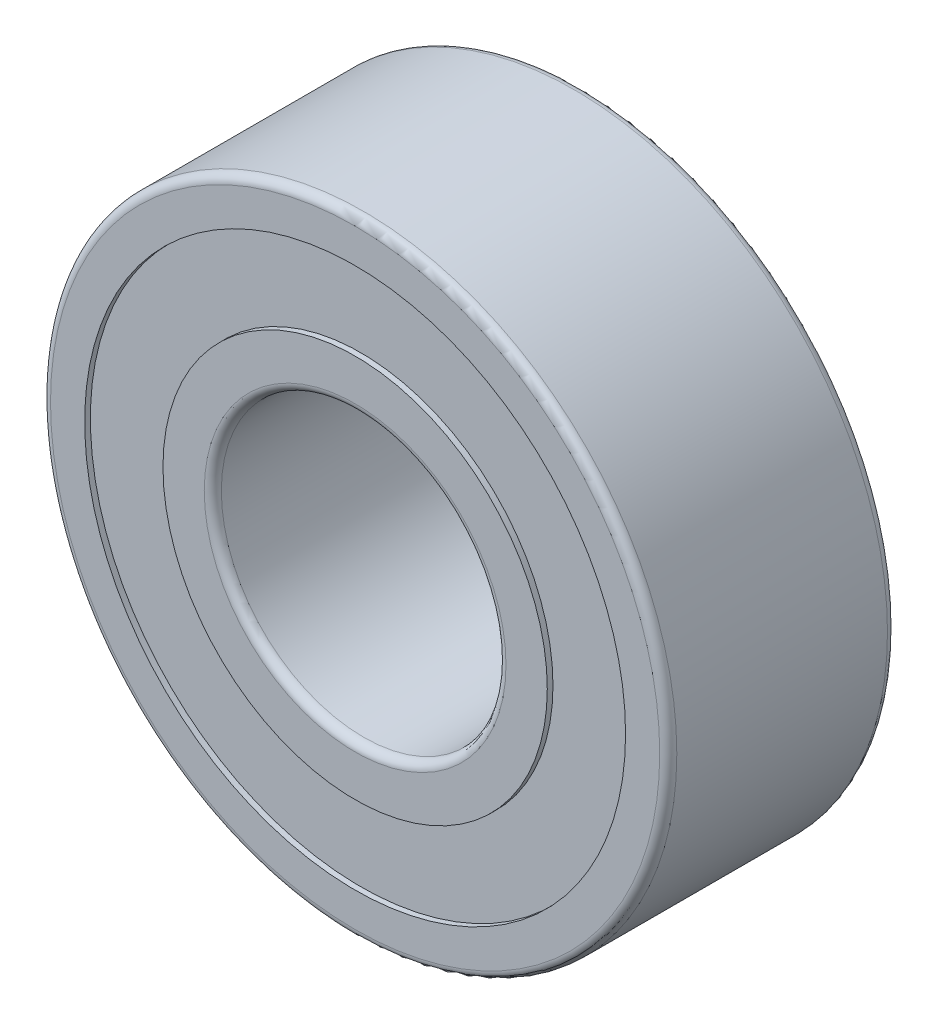
from build123d import *

# Parameters (mm, degrees)
SKETCH1_R             = 11
SKETCH1_R_2           = 5
BOSS_EXTRUDE1_DEPTH   = 4
SKETCH2_R             = 9.5
SKETCH2_R_2           = 6.75
CUT_EXTRUDE1_DEPTH    = 0.1
MIRROR1_START         = -4
MIRROR1_OUTLINE_R     = 9.5
MIRROR1_OUTLINE_R_2   = 6.75
MIRROR1_DEPTH         = 0.1
MIRROR1_START_2       = 3.8
MIRROR1_2_OUTLINE_R   = 9.5
MIRROR1_2_OUTLINE_R_2 = 6.75
MIRROR1_2_DEPTH       = 0.1
FILLET1_R             = 0.3


# Read off the part's stored shape, not the designer's step: Mirror1
with BuildPart() as part:
    # Sketch1 → Boss-Extrude1 (new, symmetric)
    with BuildSketch(Plane.XY):
        Circle(SKETCH1_R)
        Circle(SKETCH1_R_2, mode=Mode.SUBTRACT)
    extrude(amount=BOSS_EXTRUDE1_DEPTH, both=True)

    # Sketch2 → Cut-Extrude1 (cut)
    with BuildSketch(Plane.XY.offset(4)):
        Circle(SKETCH2_R)
        Circle(SKETCH2_R_2, mode=Mode.SUBTRACT)
    extrude(amount=-CUT_EXTRUDE1_DEPTH, mode=Mode.SUBTRACT)

    # Mirror1 outline → Mirror1 (cut)
    with BuildSketch(Plane.XY.offset(MIRROR1_START)):
        Circle(MIRROR1_OUTLINE_R)
        Circle(MIRROR1_OUTLINE_R_2, mode=Mode.SUBTRACT)
    extrude(amount=MIRROR1_DEPTH, mode=Mode.SUBTRACT)

    # Mirror1 2 outline → Mirror1 2 (cut)
    with BuildSketch(Plane.XY.offset(MIRROR1_START_2)):
        Circle(MIRROR1_2_OUTLINE_R)
        Circle(MIRROR1_2_OUTLINE_R_2, mode=Mode.SUBTRACT)
    extrude(amount=MIRROR1_2_DEPTH, mode=Mode.SUBTRACT)

    # Fillet1
    fillet1_edges = [part.edges().sort_by_distance(p)[0] for p in [
        (-11, 0, -4),
        (-11, 0, 4),
        (-5, 0, -4),
        (-5, 0, 4),
    ]]
    fillet(fillet1_edges, radius=FILLET1_R)


solid = part.part
